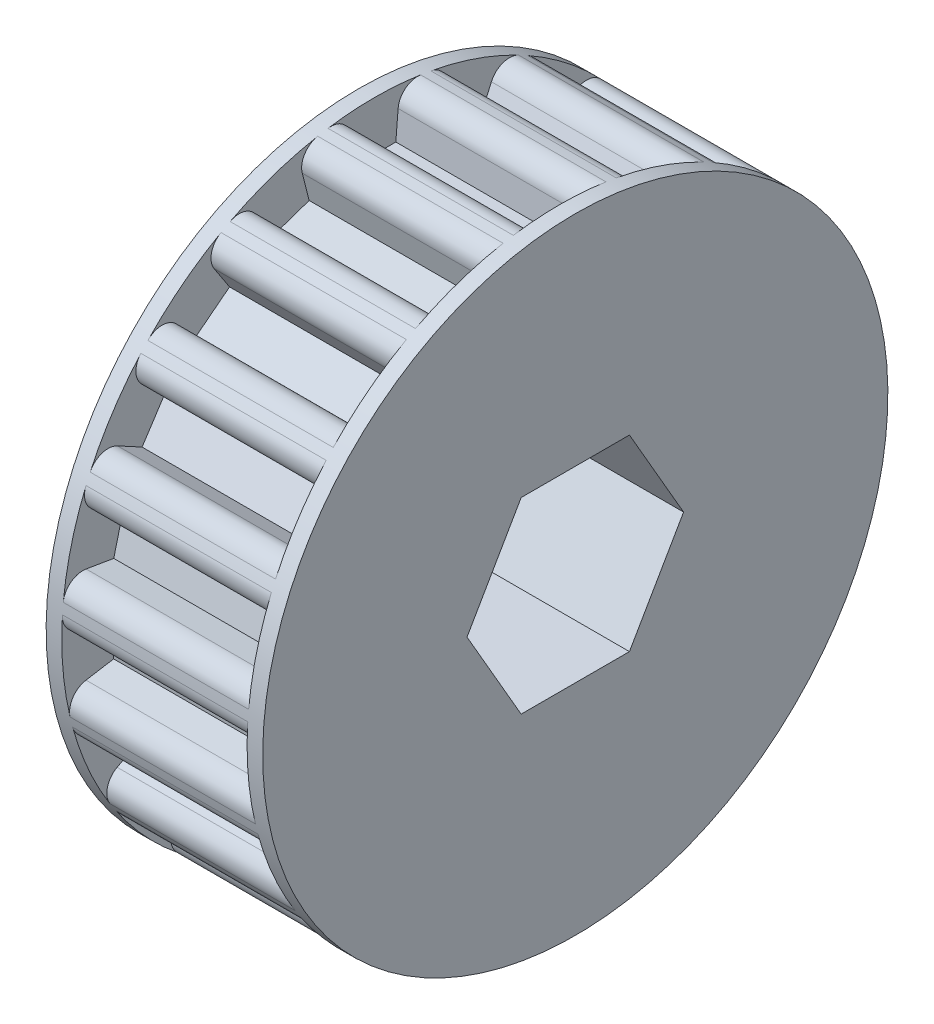
from build123d import *

# Parameters (mm, degrees)
REVOLVE1_START           = -5.5
REVOLVE1_OUTLINE_R       = 15.875
REVOLVE1_OUTLINE_R_2     = 3.175
REVOLVE1_DEPTH           = 11
CUT_EXTRUDE1_START       = -0.79375
CUT_EXTRUDE1_DEPTH       = 9.4125
FILLET1_R                = 1
CIRPATTERN1_COUNT        = 19
FILLET1_OF_CIRPATTERN1_R = 1
CUT_EXTRUDE2_DEPTH       = 26.000624992


# Read off the part's stored shape, not the designer's step: Revolve1
with BuildPart() as part:
    # Revolve1 outline → Revolve1 (new body)
    with BuildSketch(Plane.YZ.offset(REVOLVE1_START)):
        Circle(REVOLVE1_OUTLINE_R)
        Circle(REVOLVE1_OUTLINE_R_2, mode=Mode.SUBTRACT)
    extrude(amount=REVOLVE1_DEPTH)

    # Sketch2 → Cut-Extrude1 (cut)
    with BuildSketch(Plane(origin=(5.5, 0, 0), x_dir=(0, 0, -1), z_dir=(1, 0, 0)).offset(CUT_EXTRUDE1_START)):
        Polygon((-1.091836735, 13.375), (1.091836735, 13.375), (1.5, 18.375), (-1.5, 18.375), align=None)
    cut_extrude1 = extrude(amount=-CUT_EXTRUDE1_DEPTH, mode=Mode.SUBTRACT)

    # Fillet1
    fillet1_edges = [part.edges().sort_by_distance(p)[0] for p in [
        (0, 15.822368276, -1.2916219),
        (0, 15.822368276, 1.2916219),
    ]]
    fillet(fillet1_edges, radius=FILLET1_R)

    # CirPattern1: Cut-Extrude1 ×19 about axis
    cirpattern1_axis = Axis((0, 0, 0), (1, 0, 0))
    for i in range(1, CIRPATTERN1_COUNT):
        add(cut_extrude1.rotate(cirpattern1_axis, i * 360 / CIRPATTERN1_COUNT), mode=Mode.SUBTRACT)

    # Fillet1 of CirPattern1
    fillet1_of_cirpattern1_edges = [part.edges().sort_by_distance(p)[0] for p in [
        (0, 15.384457666, 3.915876318),
        (0, 14.545679775, 6.359152844),
        (0, 13.279402352, 8.699028576),
        (0, 11.69274117, 10.737570904),
        (0, 9.735317743, 12.539506108),
        (0, 7.572712628, 13.952406547),
        (0, 5.136260397, 15.021133583),
        (0, 2.632063171, 15.655282446),
        (0, -0.01939046, 15.874988158),
        (0, -2.593811173, 15.661665576),
        (0, -5.172940059, 15.008541439),
        (0, -7.538605828, 13.970864224),
        (0, -9.765921337, 12.515686375),
        (0, -11.666475568, 10.766102954),
        (0, -13.300613505, 8.66656249),
        (0, -14.530101657, 6.394667375),
        (0, -15.393977818, 3.878282085),
        (0, -15.819165773, 1.330270363),
        (0, -15.819165773, -1.330270363),
        (0, -15.393977818, -3.878282085),
        (0, -14.530101657, -6.394667375),
        (0, -13.300613505, -8.66656249),
        (0, -11.666475568, -10.766102954),
        (0, -9.765921337, -12.515686375),
        (0, -7.538605828, -13.970864224),
        (0, -5.172940059, -15.008541439),
        (0, -2.593811173, -15.661665576),
        (0, -0.01939046, -15.874988158),
        (0, 2.632063171, -15.655282446),
        (0, 5.136260397, -15.021133583),
        (0, 7.572712628, -13.952406547),
        (0, 9.735317743, -12.539506108),
        (0, 11.69274117, -10.737570904),
        (0, 13.279402352, -8.699028576),
        (0, 14.545679775, -6.359152844),
        (0, 15.384457666, -3.915876318),
    ]]
    fillet(fillet1_of_cirpattern1_edges, radius=FILLET1_OF_CIRPATTERN1_R)

    # Sketch3 → Cut-Extrude2 (cut, through all)
    with BuildSketch(Plane(origin=(5.5, 0, 0), x_dir=(0, 0, -1), z_dir=(1, 0, 0))):
        Polygon((5.499261314, 0), (2.749630657, 4.7625), (-2.749630657, 4.7625), (-5.499261314, 0), (-2.749630657, -4.7625), (2.749630657, -4.7625), align=None)
    extrude(amount=-CUT_EXTRUDE2_DEPTH, mode=Mode.SUBTRACT)


solid = part.part
